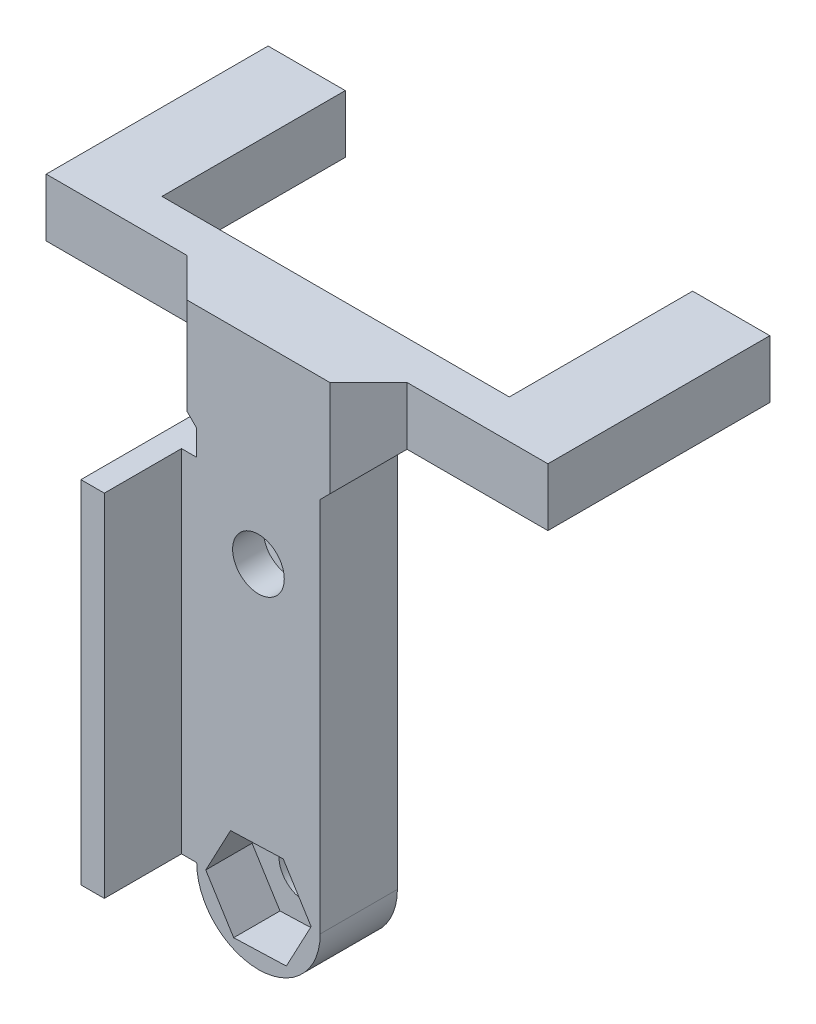
from build123d import *

# Parameters (mm, degrees)
SKETCH2_R           = 1.700000029
BOSS_EXTRUDE1_DEPTH = 5.08
SKETCH4_W           = 2.54
SKETCH4_H           = 23.100716355
BOSS_EXTRUDE3_DEPTH = 5.08
BOSS_EXTRUDE4_START = -5.08
SKETCH4_4_W         = 1.54
SKETCH4_4_H         = 23.100716355
BOSS_EXTRUDE4_DEPTH = 5.08
CUT_EXTRUDE1_START  = -3.048
SKETCH5_R           = 1.700000029
CUT_EXTRUDE1_DEPTH  = 3.048
CUT_EXTRUDE2_DEPTH  = 3.048
BOSS_EXTRUDE5_DEPTH = 3.81
CHAMFER4_SIZE       = 3.175
CHAMFER5_SIZE       = 3.175


with BuildPart() as part:
    # Sketch2 → Boss-Extrude1 (new body)
    with BuildSketch(Plane.XY):
        with BuildLine():
            Line((-4.064, 19.05), (-4.064, 0))
            ThreePointArc((-4.064, 0), (0, -4.064), (4.064, 0))
            Line((4.064, 0), (4.064, 19.05))
            Line((4.064, 19.05), (4.064, 31.75))
            Line((4.064, 31.75), (-4.064, 31.75))
            Line((-4.064, 31.75), (-4.064, 19.05))
        make_face()
        Circle(SKETCH2_R, mode=Mode.SUBTRACT)
        with Locations((0, 19.05)):
            Circle(SKETCH2_R, mode=Mode.SUBTRACT)
    extrude(amount=BOSS_EXTRUDE1_DEPTH)

    # Sketch4 → Boss-Extrude3 (add)
    with BuildSketch(Plane(origin=(0, 0, 0), x_dir=(-1, 0, 0), z_dir=(0, 0, -1))):
        with Locations((5.334, 11.550358178)):
            Rectangle(SKETCH4_W, SKETCH4_H)
    extrude(amount=-BOSS_EXTRUDE3_DEPTH)

    # Sketch4<4> → Boss-Extrude4 (add)
    with BuildSketch(Plane(origin=(0, 0, 0), x_dir=(-1, 0, 0), z_dir=(0, 0, -1)).offset(BOSS_EXTRUDE4_START)):
        with Locations((5.834, 11.550358178)):
            Rectangle(SKETCH4_4_W, SKETCH4_4_H)
    extrude(amount=-BOSS_EXTRUDE4_DEPTH)

    # Sketch5 → Cut-Extrude1 (cut)
    with BuildSketch(Plane.XY.offset(5.08).offset(CUT_EXTRUDE1_START)):
        Polygon((1.63025736, 3.061744972), (-1.836420245, 2.942716775), (-3.466677606, -0.119028197), (-1.63025736, -3.061744972), (1.836420245, -2.942716775), (3.466677606, 0.119028197), align=None)
        Circle(SKETCH5_R, mode=Mode.SUBTRACT)
    extrude(amount=CUT_EXTRUDE1_DEPTH, mode=Mode.SUBTRACT)

    # Sketch6 → Cut-Extrude2 (cut)
    with BuildSketch(Plane(origin=(0, 0, 0), x_dir=(-1, 0, 0), z_dir=(0, 0, -1))):
        Polygon((-3.253201396, 20.05995743), (-2.501249489, 16.737623663), (0.751951906, 15.727666232), (3.253201396, 18.04004257), (2.501249489, 21.362376337), (-0.751951906, 22.372333768), align=None)
    extrude(amount=-CUT_EXTRUDE2_DEPTH, mode=Mode.SUBTRACT)

    # Sketch9 → Boss-Extrude5 (add)
    with BuildSketch(Plane(origin=(0, 31.75, 0), x_dir=(1, 0, 0), z_dir=(0, 1, 0))):
        Polygon((-16.51, 12.065), (-16.51, -2.54), (16.51, -2.54), (16.51, 12.065), (11.43, 12.065), (11.43, 0), (-11.43, 0), (-11.43, 12.065), align=None)
    extrude(amount=-BOSS_EXTRUDE5_DEPTH)

    # Chamfer4
    # the kernel refuses this chamfer: 3.175 mm, written as the material it adds along each edge
    with BuildSketch(Plane(origin=(4.064, 27.94, 2.54), x_dir=(0.9996219169112966, 0, -0.02749587661058635), z_dir=(0, 1, 0))) as chamfer4_piece_1_section:
        Polygon((CHAMFER4_SIZE * 0.999621916911, -CHAMFER4_SIZE * 0.0274958766106), (-CHAMFER4_SIZE * 0.0274958766106, -CHAMFER4_SIZE * 0.999621916911), (0, 0), align=None)
    chamfer4_piece_1 = extrude(amount=3.81, mode=Mode.PRIVATE)
    chamfer4_piece_1 = split(chamfer4_piece_1, bisect_by=Plane(origin=(5.161655959, 29.845, 5.08), z_dir=(0, 0, -1)), keep=Keep.TOP, mode=Mode.PRIVATE)
    add(chamfer4_piece_1)
    with BuildSketch(Plane(origin=(-4.064, 31.75, 2.54), x_dir=(0.02749587661058607, 0, 0.9996219169112968), z_dir=(0, -1, 0))) as chamfer4_piece_2_section:
        Polygon((CHAMFER4_SIZE * 0.999621916911, CHAMFER4_SIZE * 0.0274958766106), (-CHAMFER4_SIZE * 0.0274958766106, CHAMFER4_SIZE * 0.999621916911), (0, 0), align=None)
    chamfer4_piece_2 = extrude(amount=3.81, mode=Mode.PRIVATE)
    chamfer4_piece_2 = split(chamfer4_piece_2, bisect_by=Plane(origin=(-5.161655959, 29.845, 5.08), z_dir=(0, 0, -1)), keep=Keep.TOP, mode=Mode.PRIVATE)
    add(chamfer4_piece_2)

    # Chamfer5
    chamfer5_edges = [part.edges().sort_by_distance(p)[0] for p in [
        (4.064, 27.94, 2.54),
        (-4.064, 27.94, 2.54),
    ]]
    chamfer(chamfer5_edges, length=CHAMFER5_SIZE)


solid = part.part
